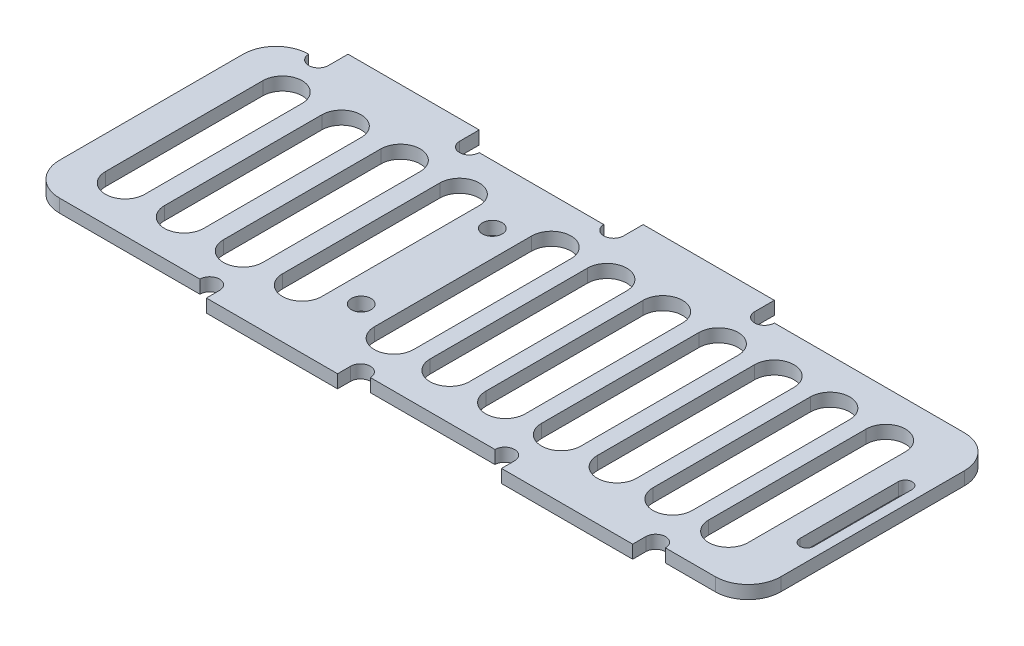
from build123d import *

# Parameters (mm, degrees)
SKETCH_1_W          = 110
SKETCH_1_H          = 38
EXTRUDE_1_DEPTH     = 2
SKETCH_2_W          = 20
SKETCH_2_H          = 2
EXTRUDE_2_DEPTH     = 3
SKETCH_4_W          = 20
SKETCH_4_H          = 2
EXTRUDE_3_DEPTH     = 2
CUT_EXTRUDE_2_DEPTH = 60.270566051
SKETCH_7_R          = 1.5
CUT_EXTRUDE_4_DEPTH = 60.270566051
SKETCH_13_R         = 1.5
CUT_EXTRUDE_6_DEPTH = 60.270566051
FILLET_1_R          = 5
CUT_EXTRUDE_8_DEPTH = 60.270566051


with BuildPart() as part:
    # 草图1 → 凸台-拉伸1 (new body)
    with BuildSketch(Plane(origin=(0, 0, 0), x_dir=(1, 0, 0), z_dir=(0, 1, 0))):
        Rectangle(SKETCH_1_W, SKETCH_1_H)
    extrude(amount=EXTRUDE_1_DEPTH)

    # 草图2 → 凸台-拉伸2 (add)
    with BuildSketch(Plane(origin=(0, 0, -19), x_dir=(-1, 0, 0), z_dir=(0, 0, -1))):
        with Locations((-8, 1)):
            Rectangle(SKETCH_2_W, SKETCH_2_H)
        with Locations((37, 1)):
            Rectangle(SKETCH_2_W, SKETCH_2_H)
    extrude(amount=EXTRUDE_2_DEPTH)

    # 草图4 → 凸台-拉伸3 (add)
    with BuildSketch(Plane.XY.offset(19)):
        with Locations((-15.6, 1)):
            Rectangle(SKETCH_4_W, SKETCH_4_H)
        with Locations((29.4, 1)):
            Rectangle(SKETCH_4_W, SKETCH_4_H)
    extrude(amount=EXTRUDE_3_DEPTH)

    # 草图6 → 切除-拉伸2 (cut, through all)
    with BuildSketch(Plane.XZ):
        with BuildLine():
            Line((53.5, 7.5), (53.5, -7.5))
            ThreePointArc((53.5, -7.5), (52.45, -8.55), (51.4, -7.5))
            Line((51.4, -7.5), (51.4, 7.5))
            ThreePointArc((51.4, 7.5), (52.45, 8.55), (53.5, 7.5))
        make_face()
    extrude(amount=-CUT_EXTRUDE_2_DEPTH, mode=Mode.SUBTRACT)

    # 草图7 → 切除-拉伸4 (cut, through all)
    with BuildSketch(Plane.XZ):
        with Locations(Location((-13, -10, 0), (0, 0, 270))):
            Circle(SKETCH_7_R)
        with Locations(Location((-13, 10, 0), (0, 0, 270))):
            Circle(SKETCH_7_R)
    extrude(amount=-CUT_EXTRUDE_4_DEPTH, mode=Mode.SUBTRACT)

    # 草图13 → 切除-拉伸6 (cut, through all)
    with BuildSketch(Plane(origin=(0, 2, 0), x_dir=(1, 0, 0), z_dir=(0, 1, 0))):
        with Locations((-48.5, 19)):
            Circle(SKETCH_13_R)
        with Locations((-25.5, 19)):
            Circle(SKETCH_13_R)
        with Locations((-3.5, 19)):
            Circle(SKETCH_13_R)
        with Locations((19.5, 19)):
            Circle(SKETCH_13_R)
        with Locations((-27.1, -19)):
            Circle(SKETCH_13_R)
        with Locations((-4.1, -19)):
            Circle(SKETCH_13_R)
        with Locations((17.9, -19)):
            Circle(SKETCH_13_R)
        with Locations((40.9, -19)):
            Circle(SKETCH_13_R)
    extrude(amount=-CUT_EXTRUDE_6_DEPTH, mode=Mode.SUBTRACT)

    # 圆角1
    fillet_1_edges = [part.edges().sort_by_distance(p)[0] for p in [
        (55, 1, 19),
        (-55, 1, 19),
        (-55, 1, -19),
        (55, 1, -19),
    ]]
    fillet(fillet_1_edges, radius=FILLET_1_R - 0.0001)  # a hair under: the kernel refuses the full size

    # 草图12 → 切除-拉伸8 (cut, through all)
    with BuildSketch(Plane(origin=(0, 2, 0), x_dir=(1, 0, 0), z_dir=(0, 1, 0))):
        with BuildLine():
            Line((48, 12), (48, -12))
            ThreePointArc((48, -12), (45, -15), (42, -12))
            Line((42, -12), (42, 12))
            ThreePointArc((42, 12), (45, 15), (48, 12))
        make_face()
        with BuildLine():
            Line((39.5, 12), (39.5, -12))
            ThreePointArc((39.5, -12), (36.5, -15), (33.5, -12))
            Line((33.5, -12), (33.5, 12))
            ThreePointArc((33.5, 12), (36.5, 15), (39.5, 12))
        make_face()
        with BuildLine():
            Line((31, 12), (31, -12))
            ThreePointArc((31, -12), (28, -15), (25, -12))
            Line((25, -12), (25, 12))
            ThreePointArc((25, 12), (28, 15), (31, 12))
        make_face()
        with BuildLine():
            Line((22.5, 12), (22.5, -12))
            ThreePointArc((22.5, -12), (19.5, -15), (16.5, -12))
            Line((16.5, -12), (16.5, 12))
            ThreePointArc((16.5, 12), (19.5, 15), (22.5, 12))
        make_face()
        with BuildLine():
            Line((14, 12), (14, -12))
            ThreePointArc((14, -12), (11, -15), (8, -12))
            Line((8, -12), (8, 12))
            ThreePointArc((8, 12), (11, 15), (14, 12))
        make_face()
        with BuildLine():
            Line((5.5, 12), (5.5, -12))
            ThreePointArc((5.5, -12), (2.5, -15), (-0.5, -12))
            Line((-0.5, -12), (-0.5, 12))
            ThreePointArc((-0.5, 12), (2.5, 15), (5.5, 12))
        make_face()
        with BuildLine():
            Line((-3, 12), (-3, -12))
            ThreePointArc((-3, -12), (-6, -15), (-9, -12))
            Line((-9, -12), (-9, 12))
            ThreePointArc((-9, 12), (-6, 15), (-3, 12))
        make_face()
        with BuildLine():
            Line((-17, 12), (-17, -12))
            ThreePointArc((-17, -12), (-20, -15), (-23, -12))
            Line((-23, -12), (-23, 12))
            ThreePointArc((-23, 12), (-20, 15), (-17, 12))
        make_face()
        with BuildLine():
            Line((-26, 12), (-26, -12))
            ThreePointArc((-26, -12), (-29, -15), (-32, -12))
            Line((-32, -12), (-32, 12))
            ThreePointArc((-32, 12), (-29, 15), (-26, 12))
        make_face()
        with BuildLine():
            Line((-35, 12), (-35, -12))
            ThreePointArc((-35, -12), (-38, -15), (-41, -12))
            Line((-41, -12), (-41, 12))
            ThreePointArc((-41, 12), (-38, 15), (-35, 12))
        make_face()
        with BuildLine():
            Line((-44, 12), (-44, -12))
            ThreePointArc((-44, -12), (-47, -15), (-50, -12))
            Line((-50, -12), (-50, 12))
            ThreePointArc((-50, 12), (-47, 15), (-44, 12))
        make_face()
    extrude(amount=-CUT_EXTRUDE_8_DEPTH, mode=Mode.SUBTRACT)


solid = part.part
